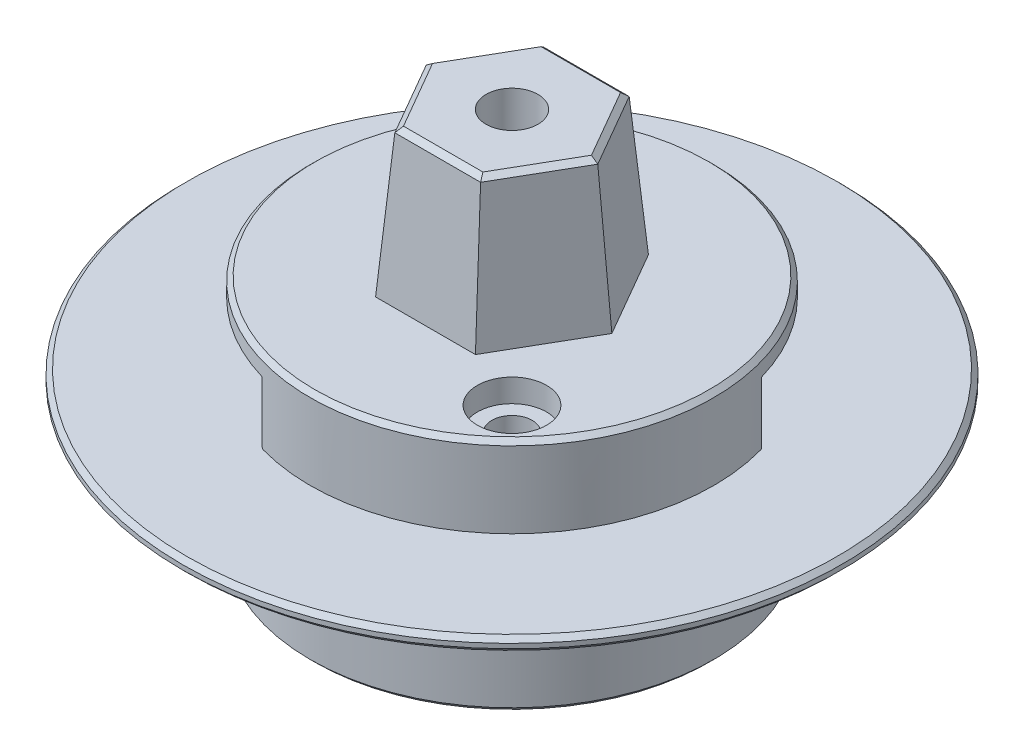
from build123d import *
from OCP.BRepFilletAPI import BRepFilletAPI_MakeChamfer

# Parameters (mm, degrees)
SKETCH1_R                                      = 17.5
SKETCH1_R_2                                    = 1.75
MAIN_BOSS_DEPTH                                = 5.28698
SKETCH3_R                                      = 14.8987
SKETCH3_R_2                                    = 1.75
CODEWHEEL_CENTER_BOSS_DEPTH                    = 0.5
CODEWHEEL_START                                = -0.4
SKETCH4_R                                      = 16.5
SKETCH4_R_2                                    = 14.8987
CODEWHEEL_RELIEF_CUT_DEPTH                     = 0.4
CODEWHEEL_RELIEF_CHAMFER_SIZE                  = 0.4
SKETCH6_R                                      = 17.5
SKETCH6_R_2                                    = 16.5
CODEWHEEL_TOP_BOSS_DEPTH                       = 1
SKETCH7_R                                      = 17.5
SKETCH7_R_2                                    = 1.75
SECONDARY_BOSS_DEPTH                           = 7
CODEWHEEL_RELIEF_CHAMFER_2_SIZE                = 1
SKETCH8_R                                      = 3
MOTOR_BOLT_COUNTERSINKS_DEPTH                  = 5
EDGE_CHAMFERS_1_SIZE                           = 0.4
EDGE_CHAMFERS_2_SIZE                           = 0.4
ACCELEROMETER_NOTCH_DEPTH                      = 2
SKETCH13_R                                     = 2.35
ACCELEROMETER_LAYER_HEAT_SET_INSERT_HOLE_DEPTH = 4.2
SKETCH14_R                                     = 1.75
ACCELEROMETER_LAYER_BOLT_THROUGH_HOLES_DEPTH   = 2
SKETCH15_R                                     = 1.75
ACCELEROMETER_COVER_DEPTH                      = 5
ACCELEROMETER_COVER_2_DEPTH                    = 5
SKETCH17_R                                     = 17.5
SKETCH17_R_2                                   = 1.75
ACCELEROMETER_COVER_BOSS_DEPTH                 = 2
SKETCH19_R                                     = 3
ACCLEROMETER_COVER_COUNTERSINKS_DEPTH          = 2
EDGE_CHAMFERS_3_SIZE                           = 0.4
OUTPUT_CONE_DEPTH                              = 12.5
OUTPUT_CONE_TAPER                              = 5
CHAMFER1_SIZE                                  = 0.4
CHAMFER1_SIZE2                                 = 0.440025147
SKETCH20_R                                     = 2.25
CUT_EXTRUDE1_DEPTH                             = 10
SKETCH21_R                                     = 0.8
CUT_EXTRUDE2_DEPTH                             = 5
CUT_EXTRUDE3_DEPTH                             = 2
SKETCH23_R                                     = 28.575
SKETCH23_R_2                                   = 17.1
BOSS_EXTRUDE1_DEPTH                            = 1.2
CHAMFER2_SIZE                                  = 0.4
CHAMFER3_SIZE                                  = 0.4
CHAMFER3_SIZE_2                                = 0.296094537


# Some blends are built 0.0001 mm under size
with BuildPart() as part:
    # Sketch1 → Main Boss (new body)
    with BuildSketch(Plane(origin=(0, 0, 0), x_dir=(1, 0, 0), z_dir=(0, 1, 0))):
        with Locations(Location((0, 0, 0), (0, 0, 270))):
            Circle(SKETCH1_R)
        with Locations(Location((7.5, 0, 0), (0, 0, 270))):
            Circle(SKETCH1_R_2, mode=Mode.SUBTRACT)
        with Locations(Location((0, 7.5, 0), (0, 0, 270))):
            Circle(SKETCH1_R_2, mode=Mode.SUBTRACT)
        with Locations(Location((-7.5, 0, 0), (0, 0, 270))):
            Circle(SKETCH1_R_2, mode=Mode.SUBTRACT)
        with Locations(Location((0, -7.5, 0), (0, 0, 270))):
            Circle(SKETCH1_R_2, mode=Mode.SUBTRACT)
    extrude(amount=MAIN_BOSS_DEPTH)

    # Sketch3 → Codewheel Center Boss (add)
    with BuildSketch(Plane(origin=(0, 5.28698, 0), x_dir=(1, 0, 0), z_dir=(0, 1, 0))):
        with Locations(Location((0, 0, 0), (0, 0, 270))):
            Circle(SKETCH3_R)
        with Locations(Location((-7.5, 0, 0), (0, 0, 270))):
            Circle(SKETCH3_R_2, mode=Mode.SUBTRACT)
        with Locations(Location((0, -7.5, 0), (0, 0, 270))):
            Circle(SKETCH3_R_2, mode=Mode.SUBTRACT)
        with Locations(Location((7.5, 0, 0), (0, 0, 270))):
            Circle(SKETCH3_R_2, mode=Mode.SUBTRACT)
        with Locations(Location((0, 7.5, 0), (0, 0, 270))):
            Circle(SKETCH3_R_2, mode=Mode.SUBTRACT)
    extrude(amount=CODEWHEEL_CENTER_BOSS_DEPTH)

    # Sketch4 → Codewheel Relief Cut (cut)
    with BuildSketch(Plane(origin=(0, 5.28698, 0), x_dir=(1, 0, 0), z_dir=(0, 1, 0)).offset(CODEWHEEL_START)):
        with Locations(Location((0, 0, 0), (0, 0, 270))):
            Circle(SKETCH4_R)
        with Locations(Location((0, 0, 0), (0, 0, 270))):
            Circle(SKETCH4_R_2, mode=Mode.SUBTRACT)
    extrude(amount=CODEWHEEL_RELIEF_CUT_DEPTH, mode=Mode.SUBTRACT)

    # Codewheel Relief Chamfer
    codewheel_relief_chamfer_edges = [part.edges().sort_by_distance(p)[0] for p in [
        (0, 4.88698, -16.5),
    ]]
    chamfer(codewheel_relief_chamfer_edges, length=CODEWHEEL_RELIEF_CHAMFER_SIZE - 0.0001)  # a hair under: the kernel refuses the full size

    # Edge Chamfers 1
    edge_chamfers_1_edges = [part.edges().sort_by_distance(p)[0] for p in [
        (0, 0, -17.5),
        (0, 5.28698, -17.5),
    ]]
    chamfer(edge_chamfers_1_edges, length=EDGE_CHAMFERS_1_SIZE)


with BuildPart() as body_2:
    # Sketch6 → Codewheel Top Boss (new body)
    with BuildSketch(Plane(origin=(0, 5.46478, 0), x_dir=(1, 0, 0), z_dir=(0, 1, 0))):
        with Locations(Location((0, 0, 0), (0, 0, 270))):
            Circle(SKETCH6_R)
        with Locations(Location((0, 0, 0), (0, 0, 270))):
            Circle(SKETCH6_R_2, mode=Mode.SUBTRACT)
    extrude(amount=CODEWHEEL_TOP_BOSS_DEPTH)

    # Sketch7 → Secondary Boss (add)
    with BuildSketch(Plane(origin=(0, 6.46478, 0), x_dir=(1, 0, 0), z_dir=(0, 1, 0))):
        with Locations(Location((0, 0, 0), (0, 0, 270))):
            Circle(SKETCH7_R)
        with Locations(Location((0, -7.5, 0), (0, 0, 270))):
            Circle(SKETCH7_R_2, mode=Mode.SUBTRACT)
        with Locations(Location((7.5, 0, 0), (0, 0, 270))):
            Circle(SKETCH7_R_2, mode=Mode.SUBTRACT)
        with Locations(Location((-7.5, 0, 0), (0, 0, 270))):
            Circle(SKETCH7_R_2, mode=Mode.SUBTRACT)
        with Locations(Location((0, 7.5, 0), (0, 0, 270))):
            Circle(SKETCH7_R_2, mode=Mode.SUBTRACT)
    extrude(amount=SECONDARY_BOSS_DEPTH)

    # Codewheel Relief Chamfer 2
    codewheel_relief_chamfer_2_edges = [body_2.edges().sort_by_distance(p)[0] for p in [
        (0, 6.46478, -16.5),
    ]]
    chamfer(codewheel_relief_chamfer_2_edges, length=CODEWHEEL_RELIEF_CHAMFER_2_SIZE - 0.0001)  # a hair under: the kernel refuses the full size

    # Sketch8 → Motor Bolt Countersinks (cut)
    with BuildSketch(Plane(origin=(0, 13.46478, 0), x_dir=(1, 0, 0), z_dir=(0, 1, 0))):
        with Locations(Location((-7.5, 0, 0), (0, 0, 270))):
            Circle(SKETCH8_R)
        with Locations(Location((0, 7.5, 0), (0, 0, 270))):
            Circle(SKETCH8_R)
        with Locations(Location((7.5, 0, 0), (0, 0, 270))):
            Circle(SKETCH8_R)
        with Locations(Location((0, -7.5, 0), (0, 0, 270))):
            Circle(SKETCH8_R)
    extrude(amount=-MOTOR_BOLT_COUNTERSINKS_DEPTH, mode=Mode.SUBTRACT)

    # Edge Chamfers 2
    edge_chamfers_2_edges = [body_2.edges().sort_by_distance(p)[0] for p in [
        (0, 13.46478, -17.5),
        (0, 5.46478, -17.5),
    ]]
    chamfer(edge_chamfers_2_edges, length=EDGE_CHAMFERS_2_SIZE)

    # Sketch11 → Accelerometer Notch (cut)
    with BuildSketch(Plane(origin=(0, 13.46478, 0), x_dir=(1, 0, 0), z_dir=(0, 1, 0))):
        Polygon((-16.164461018, -1.796051224), (1.796051224, 16.164461018), (16.164461018, 1.796051224), (-1.796051224, -16.164461018), align=None)
    extrude(amount=-ACCELEROMETER_NOTCH_DEPTH, mode=Mode.SUBTRACT)

    # Sketch13 → Accelerometer Layer Heat Set Insert Holes (cut)
    with BuildSketch(Plane(origin=(0, 13.46478, 0), x_dir=(1, 0, 0), z_dir=(0, 1, 0))):
        with Locations(Location((-9.722718241, 9.722718241, 0), (0, 0, 270))):
            Circle(SKETCH13_R)
        with Locations(Location((9.722718241, -9.722718241, 0), (0, 0, 270))):
            Circle(SKETCH13_R)
    extrude(amount=-ACCELEROMETER_LAYER_HEAT_SET_INSERT_HOLE_DEPTH, mode=Mode.SUBTRACT)

    # Sketch14 → Accelerometer Layer Bolt Through Holes (cut)
    with BuildSketch(Plane(origin=(0, 9.26478, 0), x_dir=(1, 0, 0), z_dir=(0, 1, 0))):
        with Locations(Location((-9.722718241, 9.722718241, 0), (0, 0, 270))):
            Circle(SKETCH14_R)
        with Locations(Location((9.722718241, -9.722718241, 0), (0, 0, 270))):
            Circle(SKETCH14_R)
    extrude(amount=-ACCELEROMETER_LAYER_BOLT_THROUGH_HOLES_DEPTH, mode=Mode.SUBTRACT)

    # Sketch21 → Cut-Extrude2 (cut)
    with BuildSketch(Plane(origin=(0, 11.46478, 0), x_dir=(1, 0, 0), z_dir=(0, 1, 0))):
        with Locations(Location((1.796051224, 12.572358569, 0), (0, 0, 270))):
            Circle(SKETCH21_R)
        with Locations(Location((-12.572358569, -1.796051224, 0), (0, 0, 270))):
            Circle(SKETCH21_R)
        with Locations(Location((-1.796051224, -12.572358569, 0), (0, 0, 270))):
            Circle(SKETCH21_R)
        with Locations(Location((12.572358569, 1.796051224, 0), (0, 0, 270))):
            Circle(SKETCH21_R)
    extrude(amount=-CUT_EXTRUDE2_DEPTH, mode=Mode.SUBTRACT)

    # Sketch22 → Cut-Extrude3 (cut)
    with BuildSketch(Plane(origin=(0, 13.46478, 0), x_dir=(1, 0, 0), z_dir=(0, 1, 0))):
        Polygon((-1.796051224, -16.518014409), (16.518014409, 1.796051224), (1.796051224, 16.518014409), (-16.518014409, -1.796051224), align=None)
    extrude(amount=-CUT_EXTRUDE3_DEPTH, mode=Mode.SUBTRACT)

    # Sketch23 → Boss-Extrude1 (add)
    with BuildSketch(Plane(origin=(0, 13.46478, 0), x_dir=(1, 0, 0), z_dir=(0, 1, 0))):
        with Locations(Location((0, 0, 0), (0, 0, 270))):
            Circle(SKETCH23_R)
        Circle(SKETCH23_R_2, mode=Mode.SUBTRACT)
    extrude(amount=-BOSS_EXTRUDE1_DEPTH)

    # Chamfer2
    chamfer2_edges = [body_2.edges().sort_by_distance(p)[0] for p in [
        (-9.157032816, 13.46478, 9.157032816),
        (7.360981592, 13.46478, 7.360981592),
        (9.157032816, 13.46478, -9.157032816),
        (-7.360981592, 13.46478, -7.360981592),
        (0, 12.26478, -28.575),
        (0, 13.46478, -28.575),
    ]]
    chamfer(chamfer2_edges, length=CHAMFER2_SIZE)


with BuildPart() as body_3:
    # Sketch15 → Accelerometer Cover (new body)
    with BuildSketch(Plane(origin=(0, 13.46478, 0), x_dir=(1, 0, 0), z_dir=(0, 1, 0))):
        with BuildLine():
            Line((-16.716780818, -5.176798149), (5.176798149, 16.716780818))
            ThreePointArc((5.176798149, 16.716780818), (-12.374368671, 12.374368671), (-16.716780818, -5.176798149))
        make_face()
        with Locations(Location((-9.722718241, 9.722718241, 0), (0, 0, 270))):
            Circle(SKETCH15_R, mode=Mode.SUBTRACT)
    extrude(amount=ACCELEROMETER_COVER_DEPTH)



with BuildPart() as body_4:
    # Sketch15 → Accelerometer Cover 2 (new body)
    with BuildSketch(Plane(origin=(0, 13.46478, 0), x_dir=(1, 0, 0), z_dir=(0, 1, 0))):
        with BuildLine():
            Line((-5.176798149, -16.716780818), (16.716780818, 5.176798149))
            ThreePointArc((16.716780818, 5.176798149), (12.374368671, -12.374368671), (-5.176798149, -16.716780818))
        make_face()
        with Locations(Location((9.722718241, -9.722718241, 0), (0, 0, 270))):
            Circle(SKETCH15_R, mode=Mode.SUBTRACT)
    extrude(amount=ACCELEROMETER_COVER_2_DEPTH)


with BuildPart() as body_3_1:
    add(body_3.part)

    add(body_4.part)  # Accelerometer Cover Boss merges body 4
    # Sketch17 → Accelerometer Cover Boss (add)
    with BuildSketch(Plane(origin=(0, 18.46478, 0), x_dir=(1, 0, 0), z_dir=(0, 1, 0))):
        with Locations(Location((0, 0, 0), (0, 0, 72.793463048))):
            Circle(SKETCH17_R)
        with Locations(Location((9.722718241, -9.722718241, 0), (0, 0, 270))):
            Circle(SKETCH17_R_2, mode=Mode.SUBTRACT)
        with Locations(Location((-9.722718241, 9.722718241, 0), (0, 0, 270))):
            Circle(SKETCH17_R_2, mode=Mode.SUBTRACT)
    extrude(amount=ACCELEROMETER_COVER_BOSS_DEPTH)

    # Sketch19 → Acclerometer Cover Countersinks (cut)
    with BuildSketch(Plane(origin=(0, 20.46478, 0), x_dir=(1, 0, 0), z_dir=(0, 1, 0))):
        with Locations(Location((-9.722718241, 9.722718241, 0), (0, 0, 270))):
            Circle(SKETCH19_R)
        with Locations(Location((9.722718241, -9.722718241, 0), (0, 0, 270))):
            Circle(SKETCH19_R)
    extrude(amount=-ACCLEROMETER_COVER_COUNTERSINKS_DEPTH, mode=Mode.SUBTRACT)

    # Edge Chamfers 3
    edge_chamfers_3_edges = [body_3_1.edges().sort_by_distance(p)[0] for p in [
        (-5.176798149, 20.46478, 16.716780818),
        (-12.374368671, 13.46478, -12.374368671),
    ]]
    chamfer(edge_chamfers_3_edges, length=EDGE_CHAMFERS_3_SIZE)

    # Sketch18 → Output Cone (add)
    with BuildSketch(Plane(origin=(0, 20.46478, 0), x_dir=(1, 0, 0), z_dir=(0, 1, 0))):
        Polygon((4.330127019, 7.5), (-4.330127019, 7.5), (-8.660254038, 0), (-4.330127019, -7.5), (4.330127019, -7.5), (8.660254038, 0), align=None)
    extrude(amount=OUTPUT_CONE_DEPTH, taper=OUTPUT_CONE_TAPER)

    # Chamfer1: one chamfer whose edges measure the first distance from different faces: ONE call of the kernel's chamfer builder (chamfer() names one face for all edges)
    chamfer1_edges_1 = [body_3_1.edges().sort_by_distance(p)[0] for p in [
        (5.548097964, 32.96478, -3.203195853),
    ]]
    chamfer1_side_1 = [body_3_1.faces().sort_by_distance(p)[0] for p in [
        (6.034057582, 26.550945221, -3.483764769),
    ]]
    chamfer1_edges_2 = [body_3_1.edges().sort_by_distance(p)[0] for p in [
        (0, 32.96478, -6.406391706),
    ]]
    chamfer1_side_2 = [body_3_1.faces().sort_by_distance(p)[0] for p in [
        (0, 26.550945221, -6.967529539),
    ]]
    chamfer1_edges_3 = [body_3_1.edges().sort_by_distance(p)[0] for p in [
        (-5.548097964, 32.96478, -3.203195853),
    ]]
    chamfer1_side_3 = [body_3_1.faces().sort_by_distance(p)[0] for p in [
        (-6.034057582, 26.550945221, -3.483764769),
    ]]
    chamfer1_edges_4 = [body_3_1.edges().sort_by_distance(p)[0] for p in [
        (-5.548097964, 32.96478, 3.203195853),
    ]]
    chamfer1_side_4 = [body_3_1.faces().sort_by_distance(p)[0] for p in [
        (-6.034057582, 26.550945221, 3.483764769),
    ]]
    chamfer1_edges_5 = [body_3_1.edges().sort_by_distance(p)[0] for p in [
        (0, 32.96478, 6.406391706),
    ]]
    chamfer1_side_5 = [body_3_1.faces().sort_by_distance(p)[0] for p in [
        (0, 26.550945221, 6.967529539),
    ]]
    chamfer1_edges_6 = [body_3_1.edges().sort_by_distance(p)[0] for p in [
        (5.548097964, 32.96478, 3.203195853),
    ]]
    chamfer1_side_6 = [body_3_1.faces().sort_by_distance(p)[0] for p in [
        (6.034057582, 26.550945221, 3.483764769),
    ]]
    chamfer1 = BRepFilletAPI_MakeChamfer(body_3_1.part.solid().wrapped)
    for e in chamfer1_edges_1:
        chamfer1.Add(CHAMFER1_SIZE, CHAMFER1_SIZE2, e.wrapped, chamfer1_side_1[0].wrapped)  # the first distance lies on this face
    for e in chamfer1_edges_2:
        chamfer1.Add(CHAMFER1_SIZE, CHAMFER1_SIZE2, e.wrapped, chamfer1_side_2[0].wrapped)  # the first distance lies on this face
    for e in chamfer1_edges_3:
        chamfer1.Add(CHAMFER1_SIZE, CHAMFER1_SIZE2, e.wrapped, chamfer1_side_3[0].wrapped)  # the first distance lies on this face
    for e in chamfer1_edges_4:
        chamfer1.Add(CHAMFER1_SIZE, CHAMFER1_SIZE2, e.wrapped, chamfer1_side_4[0].wrapped)  # the first distance lies on this face
    for e in chamfer1_edges_5:
        chamfer1.Add(CHAMFER1_SIZE, CHAMFER1_SIZE2, e.wrapped, chamfer1_side_5[0].wrapped)  # the first distance lies on this face
    for e in chamfer1_edges_6:
        chamfer1.Add(CHAMFER1_SIZE, CHAMFER1_SIZE2, e.wrapped, chamfer1_side_6[0].wrapped)  # the first distance lies on this face
    add(Compound.cast(chamfer1.Shape()), mode=Mode.REPLACE)

    # Sketch20 → Cut-Extrude1 (cut)
    with BuildSketch(Plane(origin=(0, 32.96478, 0), x_dir=(1, 0, 0), z_dir=(0, 1, 0))):
        with Locations(Location((0, 0, 0), (0, 0, 270))):
            Circle(SKETCH20_R)
    extrude(amount=-CUT_EXTRUDE1_DEPTH, mode=Mode.SUBTRACT)

    # Chamfer3
    # the kernel refuses this chamfer: 0.4, 0.296094537 mm, written as the material it takes off along each edge
    with BuildSketch(Plane(origin=(0, 18.46478, 0), x_dir=(-0.9709754513490905, 0, 0.23917916480628057), z_dir=(-0.23917916480628057, 0, -0.9709754513490905))) as chamfer3_piece_1_section:
        Polygon((17.5, CHAMFER3_SIZE), (17.5 - CHAMFER3_SIZE, 0), (17.5, 0), align=None)
    chamfer3_piece_1 = revolve(axis=Axis((0, 18.46478, 0), (0, 1, 0)), revolution_arc=62.323801839, mode=Mode.PRIVATE)
    chamfer3_piece_1 = split(chamfer3_piece_1, bisect_by=Plane(origin=(-5.769991334, 18.46478, -5.769991334), z_dir=(0.7071067811865477, 0, 0.7071067811865474)), keep=Keep.TOP, mode=Mode.PRIVATE)
    chamfer3_piece_1 = split(chamfer3_piece_1, bisect_by=Plane(origin=(5.769991334, 18.46478, 5.769991334), z_dir=(-0.7071067811865477, 0, -0.7071067811865474)), keep=Keep.TOP, mode=Mode.PRIVATE)
    add(chamfer3_piece_1, mode=Mode.SUBTRACT)
    with BuildSketch(Plane(origin=(0, 18.46478, 0), x_dir=(0.9709754513490907, 0, -0.23917916480628015), z_dir=(0.23917916480628015, 0, 0.9709754513490907))) as chamfer3_piece_2_section:
        Polygon((17.5, CHAMFER3_SIZE), (17.5 - CHAMFER3_SIZE, 0), (17.5, 0), align=None)
    chamfer3_piece_2 = revolve(axis=Axis((0, 18.46478, 0), (0, 1, 0)), revolution_arc=62.323801838, mode=Mode.PRIVATE)
    chamfer3_piece_2 = split(chamfer3_piece_2, bisect_by=Plane(origin=(-5.769991334, 18.46478, -5.769991334), z_dir=(0.7071067811865477, 0, 0.7071067811865474)), keep=Keep.TOP, mode=Mode.PRIVATE)
    chamfer3_piece_2 = split(chamfer3_piece_2, bisect_by=Plane(origin=(5.769991334, 18.46478, 5.769991334), z_dir=(-0.7071067811865477, 0, -0.7071067811865474)), keep=Keep.TOP, mode=Mode.PRIVATE)
    add(chamfer3_piece_2, mode=Mode.SUBTRACT)
    with BuildSketch(Plane(origin=(-5.904179941, 13.46478, 17.44416261), x_dir=(0, 1, 0), z_dir=(0.7071067811865474, 0, -0.7071067811865477))) as chamfer3_piece_3:
        Polygon((CHAMFER3_SIZE, 0), (0, CHAMFER3_SIZE), (0, 0), align=None)
    extrude(amount=33.019542695, mode=Mode.SUBTRACT)
    with BuildSketch(Plane(origin=(-17.123388372, 13.46478, 5.583405703), x_dir=(0, 1, 0), z_dir=(0.7071067811865474, 0, -0.7071067811865477))) as chamfer3_piece_4:
        Polygon((CHAMFER3_SIZE, 0), (0, -CHAMFER3_SIZE), (0, 0), align=None)
    extrude(amount=32.112256139, mode=Mode.SUBTRACT)
    with BuildSketch(Plane(origin=(-5.176798149, 12.436106805, 16.716780818), x_dir=(0.9577067424018318, 0, 0.2877460608906247), z_dir=(0, 1, 0))) as chamfer3_piece_5:
        with BuildLine():
            Line((0.295333321, 0), (CHAMFER3_SIZE * 0.473733741025, CHAMFER3_SIZE * 0.880668122856))
            Line((CHAMFER3_SIZE * 0.473733741025, CHAMFER3_SIZE * 0.880668122856), (0, 0))
            ThreePointArc((0, 0), (0.149967703, -0.000622872), (0.295333321, 0))
        make_face()
    extrude(amount=6.028673195, mode=Mode.SUBTRACT)
    with BuildSketch(Plane(origin=(16.716780818, 12.447527829, -5.176798149), x_dir=(0.28500238302808506, 0, 0.9585268080071171), z_dir=(0, 1, 0))) as chamfer3_piece_6:
        with BuildLine():
            Line((0.395554872, 0), (CHAMFER3_SIZE_2 * 0.476253687411, -CHAMFER3_SIZE_2 * 0.879307922132))
            Line((CHAMFER3_SIZE_2 * 0.476253687411, -CHAMFER3_SIZE_2 * 0.879307922132), (0, 0))
            ThreePointArc((0, 0), (0.203368527, 0.00111674), (0.395554872, 0))
        make_face()
    extrude(amount=6.017252171, mode=Mode.SUBTRACT)
    with BuildSketch(Plane(origin=(5.176798149, 12.836106805, -16.716780818), x_dir=(-0.9577067424018358, 0, -0.28774606089061117), z_dir=(0, 1, 0))) as chamfer3_piece_7:
        with BuildLine():
            Line((0.295333321, 0), (CHAMFER3_SIZE * 0.473733741025, CHAMFER3_SIZE * 0.880668122856))
            Line((CHAMFER3_SIZE * 0.473733741025, CHAMFER3_SIZE * 0.880668122856), (0, 0))
            ThreePointArc((0, 0), (0.149967703, -0.000622872), (0.295333321, 0))
        make_face()
    extrude(amount=5.628673195, mode=Mode.SUBTRACT)
    with BuildSketch(Plane(origin=(-16.716780818, 12.847527829, 5.176798149), x_dir=(-0.2850023830280762, 0, -0.9585268080071198), z_dir=(0, 1, 0))) as chamfer3_piece_8:
        with BuildLine():
            Line((0.395554872, 0), (CHAMFER3_SIZE_2 * 0.476253687411, -CHAMFER3_SIZE_2 * 0.879307922132))
            Line((CHAMFER3_SIZE_2 * 0.476253687411, -CHAMFER3_SIZE_2 * 0.879307922132), (0, 0))
            ThreePointArc((0, 0), (0.203368527, 0.00111674), (0.395554872, 0))
        make_face()
    extrude(amount=5.617252171, mode=Mode.SUBTRACT)
    with BuildSketch(Plane(origin=(0, 18.46478, 0), x_dir=(-0.9709754513490905, 0, 0.23917916480628057), z_dir=(-0.23917916480628057, 0, -0.9709754513490905))) as chamfer3_piece_9a_section:
        Polygon((17.5, CHAMFER3_SIZE), (17.5 - CHAMFER3_SIZE, 0), (17.5, 0), align=None)
    chamfer3_piece_9a = revolve(axis=Axis((0, 18.46478, 0), (0, 1, 0)), revolution_arc=62.323801839, mode=Mode.PRIVATE)
    chamfer3_piece_9a = split(chamfer3_piece_9a, bisect_by=Plane(origin=(-5.769991334, 18.46478, -5.769991334), z_dir=(-0.7071067811865477, 0, -0.7071067811865474)), keep=Keep.TOP, mode=Mode.PRIVATE)
    with BuildSketch(Plane(origin=(-16.716780818, 12.847527829, 5.176798149), x_dir=(-0.2850023830280762, 0, -0.9585268080071198), z_dir=(0, 1, 0))) as chamfer3_piece_9b_section:
        with BuildLine():
            Line((0.395554872, 0), (CHAMFER3_SIZE_2 * 0.476253687411, -CHAMFER3_SIZE_2 * 0.879307922132))
            Line((CHAMFER3_SIZE_2 * 0.476253687411, -CHAMFER3_SIZE_2 * 0.879307922132), (0, 0))
            ThreePointArc((0, 0), (0.203368527, 0.00111674), (0.395554872, 0))
        make_face()
    chamfer3_piece_9b = extrude(amount=6.634504342, mode=Mode.PRIVATE)
    chamfer3_piece_9b = split(chamfer3_piece_9b, bisect_by=Plane(origin=(-16.716780818, 18.46478, 5.176798149), z_dir=(0, 1, 0)), keep=Keep.TOP, mode=Mode.PRIVATE)
    chamfer3_piece_9 = chamfer3_piece_9a & chamfer3_piece_9b
    add(chamfer3_piece_9, mode=Mode.SUBTRACT)
    with BuildSketch(Plane(origin=(0, 18.46478, 0), x_dir=(-0.9709754513490905, 0, 0.23917916480628057), z_dir=(-0.23917916480628057, 0, -0.9709754513490905))) as chamfer3_piece_10a_section:
        Polygon((17.5, CHAMFER3_SIZE), (17.5 - CHAMFER3_SIZE, 0), (17.5, 0), align=None)
    chamfer3_piece_10a = revolve(axis=Axis((0, 18.46478, 0), (0, 1, 0)), revolution_arc=62.323801839, mode=Mode.PRIVATE)
    chamfer3_piece_10a = split(chamfer3_piece_10a, bisect_by=Plane(origin=(5.769991334, 18.46478, 5.769991334), z_dir=(0.7071067811865477, 0, 0.7071067811865474)), keep=Keep.TOP, mode=Mode.PRIVATE)
    with BuildSketch(Plane(origin=(-5.176798149, 12.436106805, 16.716780818), x_dir=(0.9577067424018318, 0, 0.2877460608906247), z_dir=(0, 1, 0))) as chamfer3_piece_10b_section:
        with BuildLine():
            Line((0.295333321, 0), (CHAMFER3_SIZE * 0.473733741025, CHAMFER3_SIZE * 0.880668122856))
            Line((CHAMFER3_SIZE * 0.473733741025, CHAMFER3_SIZE * 0.880668122856), (0, 0))
            ThreePointArc((0, 0), (0.149967703, -0.000622872), (0.295333321, 0))
        make_face()
    chamfer3_piece_10b = extrude(amount=7.05734639, mode=Mode.PRIVATE)
    chamfer3_piece_10b = split(chamfer3_piece_10b, bisect_by=Plane(origin=(-5.176798149, 18.46478, 16.716780818), z_dir=(0, 1, 0)), keep=Keep.TOP, mode=Mode.PRIVATE)
    chamfer3_piece_10 = chamfer3_piece_10a & chamfer3_piece_10b
    add(chamfer3_piece_10, mode=Mode.SUBTRACT)
    with BuildSketch(Plane(origin=(0, 18.46478, 0), x_dir=(0.9709754513490907, 0, -0.23917916480628015), z_dir=(0.23917916480628015, 0, 0.9709754513490907))) as chamfer3_piece_11a_section:
        Polygon((17.5, CHAMFER3_SIZE), (17.5 - CHAMFER3_SIZE, 0), (17.5, 0), align=None)
    chamfer3_piece_11a = revolve(axis=Axis((0, 18.46478, 0), (0, 1, 0)), revolution_arc=62.323801838, mode=Mode.PRIVATE)
    chamfer3_piece_11a = split(chamfer3_piece_11a, bisect_by=Plane(origin=(5.769991334, 18.46478, 5.769991334), z_dir=(0.7071067811865477, 0, 0.7071067811865474)), keep=Keep.TOP, mode=Mode.PRIVATE)
    with BuildSketch(Plane(origin=(16.716780818, 12.447527829, -5.176798149), x_dir=(0.28500238302808506, 0, 0.9585268080071171), z_dir=(0, 1, 0))) as chamfer3_piece_11b_section:
        with BuildLine():
            Line((0.395554872, 0), (CHAMFER3_SIZE_2 * 0.476253687411, -CHAMFER3_SIZE_2 * 0.879307922132))
            Line((CHAMFER3_SIZE_2 * 0.476253687411, -CHAMFER3_SIZE_2 * 0.879307922132), (0, 0))
            ThreePointArc((0, 0), (0.203368527, 0.00111674), (0.395554872, 0))
        make_face()
    chamfer3_piece_11b = extrude(amount=7.034504342, mode=Mode.PRIVATE)
    chamfer3_piece_11b = split(chamfer3_piece_11b, bisect_by=Plane(origin=(16.716780818, 18.46478, -5.176798149), z_dir=(0, 1, 0)), keep=Keep.TOP, mode=Mode.PRIVATE)
    chamfer3_piece_11 = chamfer3_piece_11a & chamfer3_piece_11b
    add(chamfer3_piece_11, mode=Mode.SUBTRACT)
    with BuildSketch(Plane(origin=(0, 18.46478, 0), x_dir=(0.9709754513490907, 0, -0.23917916480628015), z_dir=(0.23917916480628015, 0, 0.9709754513490907))) as chamfer3_piece_12a_section:
        Polygon((17.5, CHAMFER3_SIZE), (17.5 - CHAMFER3_SIZE, 0), (17.5, 0), align=None)
    chamfer3_piece_12a = revolve(axis=Axis((0, 18.46478, 0), (0, 1, 0)), revolution_arc=62.323801838, mode=Mode.PRIVATE)
    chamfer3_piece_12a = split(chamfer3_piece_12a, bisect_by=Plane(origin=(-5.769991334, 18.46478, -5.769991334), z_dir=(-0.7071067811865477, 0, -0.7071067811865474)), keep=Keep.TOP, mode=Mode.PRIVATE)
    with BuildSketch(Plane(origin=(5.176798149, 12.836106805, -16.716780818), x_dir=(-0.9577067424018358, 0, -0.28774606089061117), z_dir=(0, 1, 0))) as chamfer3_piece_12b_section:
        with BuildLine():
            Line((0.295333321, 0), (CHAMFER3_SIZE * 0.473733741025, CHAMFER3_SIZE * 0.880668122856))
            Line((CHAMFER3_SIZE * 0.473733741025, CHAMFER3_SIZE * 0.880668122856), (0, 0))
            ThreePointArc((0, 0), (0.149967703, -0.000622872), (0.295333321, 0))
        make_face()
    chamfer3_piece_12b = extrude(amount=6.65734639, mode=Mode.PRIVATE)
    chamfer3_piece_12b = split(chamfer3_piece_12b, bisect_by=Plane(origin=(5.176798149, 18.46478, -16.716780818), z_dir=(0, 1, 0)), keep=Keep.TOP, mode=Mode.PRIVATE)
    chamfer3_piece_12 = chamfer3_piece_12a & chamfer3_piece_12b
    add(chamfer3_piece_12, mode=Mode.SUBTRACT)


solid = Compound([part.part, body_2.part, body_3_1.part])
